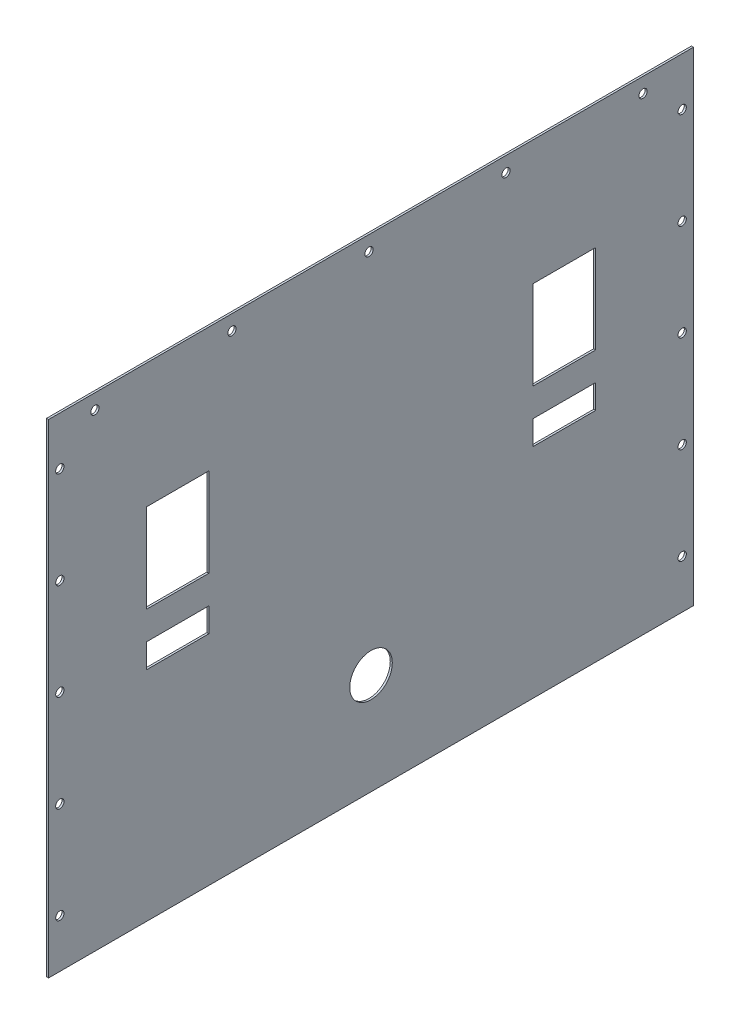
from build123d import *

# Parameters (mm, degrees)
SKETCH1_W           = 508
SKETCH1_H           = 381
BOSS_EXTRUDE1_DEPTH = 1.6002
SKETCH5_R           = 3.2639
CUT_EXTRUDE1_DEPTH  = 2.54
SKETCH7_R           = 3.2639
CUT_EXTRUDE3_DEPTH  = 2.54
SKETCH8_W           = 49.2125
SKETCH8_H           = 69.85
SKETCH8_H_2         = 19.05
CUT_EXTRUDE4_DEPTH  = 318.504032478
SKETCH9_R           = 16.764
CUT_EXTRUDE5_DEPTH  = 318.504032478


with BuildPart() as part:
    # Sketch1 → Boss-Extrude1 (new body)
    with BuildSketch(Plane(origin=(0, 0, 0), x_dir=(0, 0, -1), z_dir=(1, 0, 0))):
        Rectangle(SKETCH1_W, SKETCH1_H)
    extrude(amount=BOSS_EXTRUDE1_DEPTH)

    # Sketch5 → Cut-Extrude1 (cut)
    with BuildSketch(Plane(origin=(1.6002, 0, 0), x_dir=(0, 0, -1), z_dir=(1, 0, 0))):
        with Locations((-245.11, 152.4)):
            Circle(SKETCH5_R)
        with Locations((-245.11, 76.2)):
            Circle(SKETCH5_R)
        with Locations((-245.11, 0)):
            Circle(SKETCH5_R)
        with Locations((-245.11, -76.2)):
            Circle(SKETCH5_R)
        with Locations((-245.11, -152.4)):
            Circle(SKETCH5_R)
        with Locations((245.11, 152.4)):
            Circle(SKETCH5_R)
        with Locations((245.11, 76.2)):
            Circle(SKETCH5_R)
        with Locations((245.11, 0)):
            Circle(SKETCH5_R)
        with Locations((245.11, -76.2)):
            Circle(SKETCH5_R)
        with Locations((245.11, -152.4)):
            Circle(SKETCH5_R)
    extrude(amount=-CUT_EXTRUDE1_DEPTH, mode=Mode.SUBTRACT)

    # Sketch7 → Cut-Extrude3 (cut)
    with BuildSketch(Plane(origin=(1.6002, 0, 0), x_dir=(0, 0, -1), z_dir=(1, 0, 0))):
        with Locations((-217.5002, 178.689)):
            Circle(SKETCH7_R)
        with Locations((-109.5502, 178.689)):
            Circle(SKETCH7_R)
        with Locations((-1.6002, 178.689)):
            Circle(SKETCH7_R)
        with Locations((106.3498, 178.689)):
            Circle(SKETCH7_R)
        with Locations((214.2998, 178.689)):
            Circle(SKETCH7_R)
    extrude(amount=-CUT_EXTRUDE3_DEPTH, mode=Mode.SUBTRACT)

    # Sketch8 → Cut-Extrude4 (cut, through all)
    with BuildSketch(Plane(origin=(1.6002, 0, 0), x_dir=(0, 0, -1), z_dir=(1, 0, 0))):
        with Locations((-152.4, 57.404)):
            Rectangle(SKETCH8_W, SKETCH8_H)
        with Locations((152.4, 57.404)):
            Rectangle(SKETCH8_W, SKETCH8_H)
        with Locations((152.4, -9.271)):
            Rectangle(SKETCH8_W, SKETCH8_H_2)
        with Locations((-152.4, -9.271)):
            Rectangle(SKETCH8_W, SKETCH8_H_2)
    extrude(amount=-CUT_EXTRUDE4_DEPTH, mode=Mode.SUBTRACT)

    # Sketch9 → Cut-Extrude5 (cut, through all)
    with BuildSketch(Plane(origin=(1.6002, 0, 0), x_dir=(0, 0, -1), z_dir=(1, 0, 0))):
        with Locations((0, -110.871)):
            Circle(SKETCH9_R)
    extrude(amount=-CUT_EXTRUDE5_DEPTH, mode=Mode.SUBTRACT)


solid = part.part
